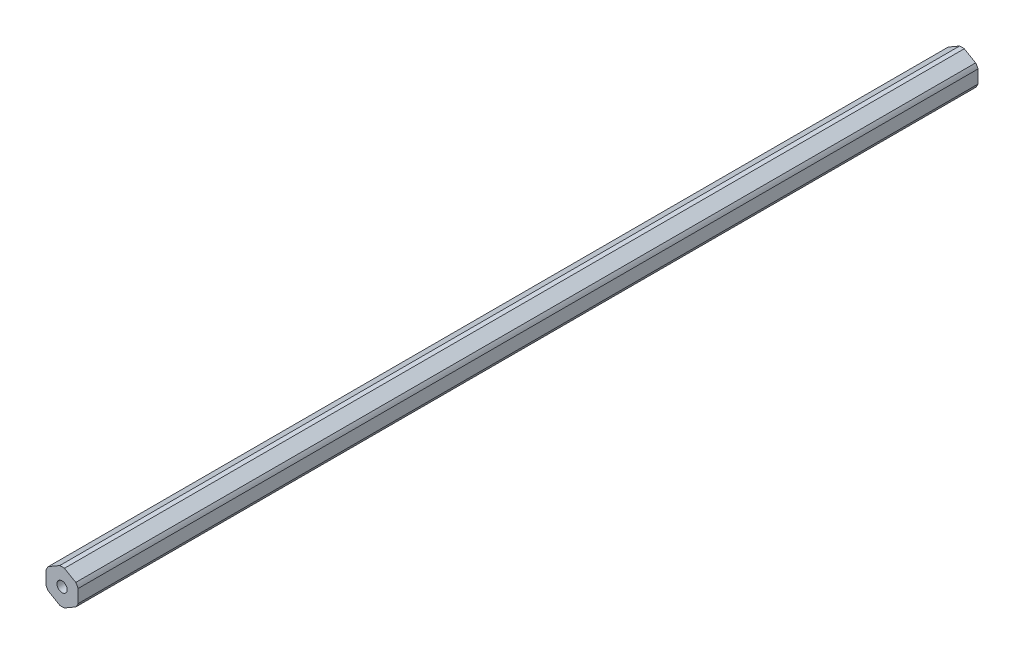
from build123d import *

# Parameters (mm, degrees)
BOSS_EXTRUDE1_DEPTH = 177.8
SKETCH2_R           = 2.0193
CUT_EXTRUDE1_DEPTH  = 356.722805937


with BuildPart() as part:
    # Sketch1 → Boss-Extrude1 (new, symmetric)
    with BuildSketch(Plane.XY):
        with BuildLine():
            ThreePointArc((0.93173274, 6.79441227), (0, 6.858), (-0.93173274, 6.79441227))
            Line((-0.93173274, 6.79441227), (-5.41826726, 4.204110358))
            ThreePointArc((-5.41826726, 4.204110358), (-5.939202219, 3.429), (-6.35, 2.590301913))
            Line((-6.35, 2.590301913), (-6.35, -2.590301913))
            ThreePointArc((-6.35, -2.590301913), (-5.939202219, -3.429), (-5.41826726, -4.204110358))
            Line((-5.41826726, -4.204110358), (-0.93173274, -6.79441227))
            ThreePointArc((-0.93173274, -6.79441227), (0, -6.858), (0.93173274, -6.79441227))
            Line((0.93173274, -6.79441227), (5.41826726, -4.204110358))
            ThreePointArc((5.41826726, -4.204110358), (5.939202219, -3.429), (6.35, -2.590301913))
            Line((6.35, -2.590301913), (6.35, 2.590301913))
            ThreePointArc((6.35, 2.590301913), (5.939202219, 3.429), (5.41826726, 4.204110358))
            Line((5.41826726, 4.204110358), (0.93173274, 6.79441227))
        make_face()
    extrude(amount=BOSS_EXTRUDE1_DEPTH, both=True)

    # Sketch2 → Cut-Extrude1 (cut, through all)
    with BuildSketch(Plane.XY.offset(177.8)):
        Circle(SKETCH2_R)
    extrude(amount=-CUT_EXTRUDE1_DEPTH, mode=Mode.SUBTRACT)


solid = part.part
